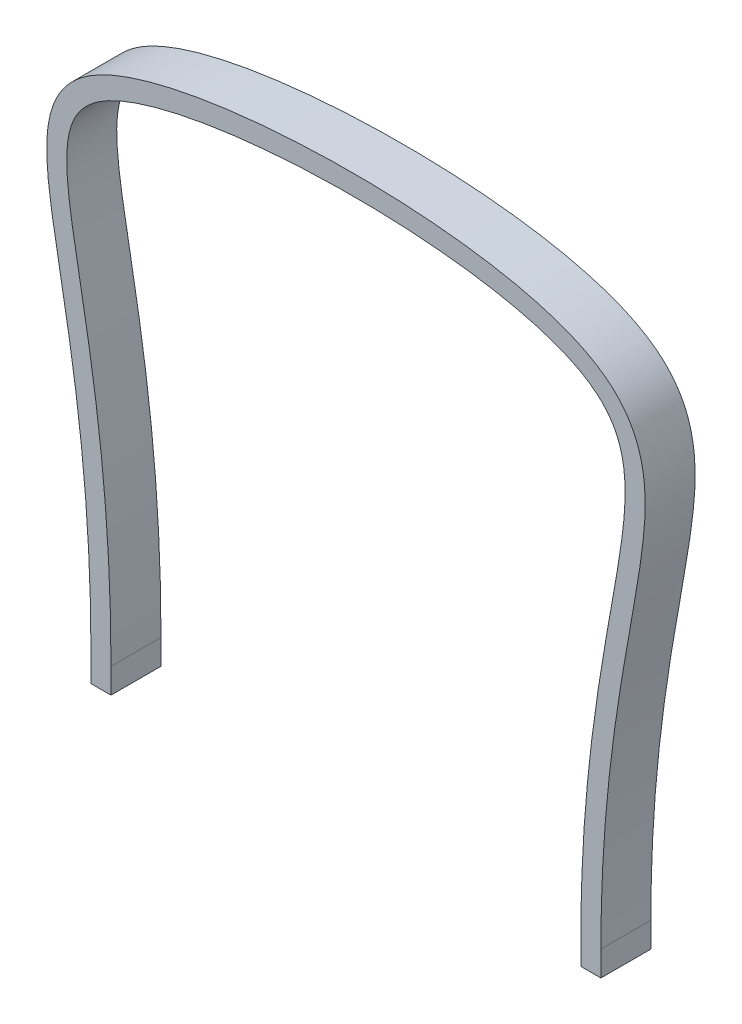
from build123d import *

# Parameters (mm, degrees)
SWEEP1_START        = -5
SWEEP1_DEPTH        = 10
SKETCH3_W           = 4
SKETCH3_H           = 10
BOSS_EXTRUDE1_DEPTH = 5


# Read off the part's stored shape, not the designer's step: Sweep1
with BuildPart() as part:
    # Sweep1 outline → Sweep1 (new body)
    with BuildSketch(Plane.XY.offset(SWEEP1_START)):
        with BuildLine():
            Line((47, 0), (51, 0))
            add(Edge.make_bspline(
                [(-51, 0), (-50.993915898, 14.007941184), (-52.691664707, 37.827296597), (-56.429582245, 59.198194397), (-58.871890861, 72.472864205), (-59.990641158, 80.956400876), (-59.848236262, 87.273622233), (-58.466697835, 92.163911555), (-56.437059969, 95.722812003), (-53.514422996, 98.724680975), (-50.79479489, 100.525327543), (-48.049709484, 101.975149446), (-45.054229501, 103.295407099), (-36.931195198, 106.001290543), (-22.103172723, 108.736204229), (-0.031588202, 110.05633756), (22.059938114, 109.04790608), (36.950649966, 106.334441294), (45.154196776, 103.414588012), (48.192806296, 101.945572906), (50.972199492, 100.312683082), (53.71254237, 98.264792872), (56.579728058, 94.90852855), (58.519173391, 91.050857061), (60.010062785, 85.148050904), (59.903300672, 76.820032734), (57.971524373, 64.660923801), (55.040859562, 48.871621499), (52.042716973, 28.179905236), (50.995701647, 10.076528293), (51, 0)],
                knots=[0, 0, 0, 0, 0.07, 0.14, 0.176666667, 0.213333333, 0.25, 0.270833333, 0.291666667, 0.3125, 0.333333333, 0.337931034, 0.354166667, 0.375, 0.4375, 0.5, 0.5625, 0.625, 0.645833333, 0.662068966, 0.666666667, 0.6875, 0.708333333, 0.729166667, 0.75, 0.796666667, 0.843333333, 0.89, 0.945, 1, 1, 1, 1], degree=3))
            Line((-51, 0), (-47, 0))
            add(Edge.make_bspline(
                [(-47, 0), (-47, 14.167890445), (-48.709917012, 38.307144378), (-52.501396266, 59.95008368), (-54.929650135, 73.154115496), (-55.993226588, 81.29234778), (-55.826687919, 86.810504607), (-54.72984305, 90.62503743), (-53.216600508, 93.275559913), (-50.981220773, 95.588645476), (-48.729771784, 97.09220003), (-46.339845551, 98.354237975), (-43.647000346, 99.544917333), (-36.053063776, 102.081231213), (-21.659751037, 104.755013771), (0, 106.048480692), (21.659751037, 105.06112318), (36.053063776, 102.412982058), (43.647000346, 99.700778102), (46.339845551, 98.394493596), (48.729771784, 96.990617721), (50.981220773, 95.295933853), (53.216600508, 92.669395376), (54.72984305, 89.669378587), (55.966710669, 84.850142215), (55.925718931, 77.301223278), (54.039908123, 65.397028587), (51.097791907, 49.546781732), (48.055612033, 28.583522397), (47, 10.211067347), (47, 0)],
                knots=[0, 0, 0, 0, 0.07, 0.14, 0.176666667, 0.213333333, 0.25, 0.270833333, 0.291666667, 0.3125, 0.333333333, 0.337931034, 0.354166667, 0.375, 0.4375, 0.5, 0.5625, 0.625, 0.645833333, 0.662068966, 0.666666667, 0.6875, 0.708333333, 0.729166667, 0.75, 0.796666667, 0.843333333, 0.89, 0.945, 1, 1, 1, 1], degree=3))
        make_face()
    extrude(amount=SWEEP1_DEPTH)

    # Sketch3 → Boss-Extrude1 (add)
    with BuildSketch(Plane.XZ):
        with Locations((-49, 0)):
            Rectangle(SKETCH3_W, SKETCH3_H)
        with Locations((49, 0)):
            Rectangle(SKETCH3_W, SKETCH3_H)
    extrude(amount=BOSS_EXTRUDE1_DEPTH)


solid = part.part
